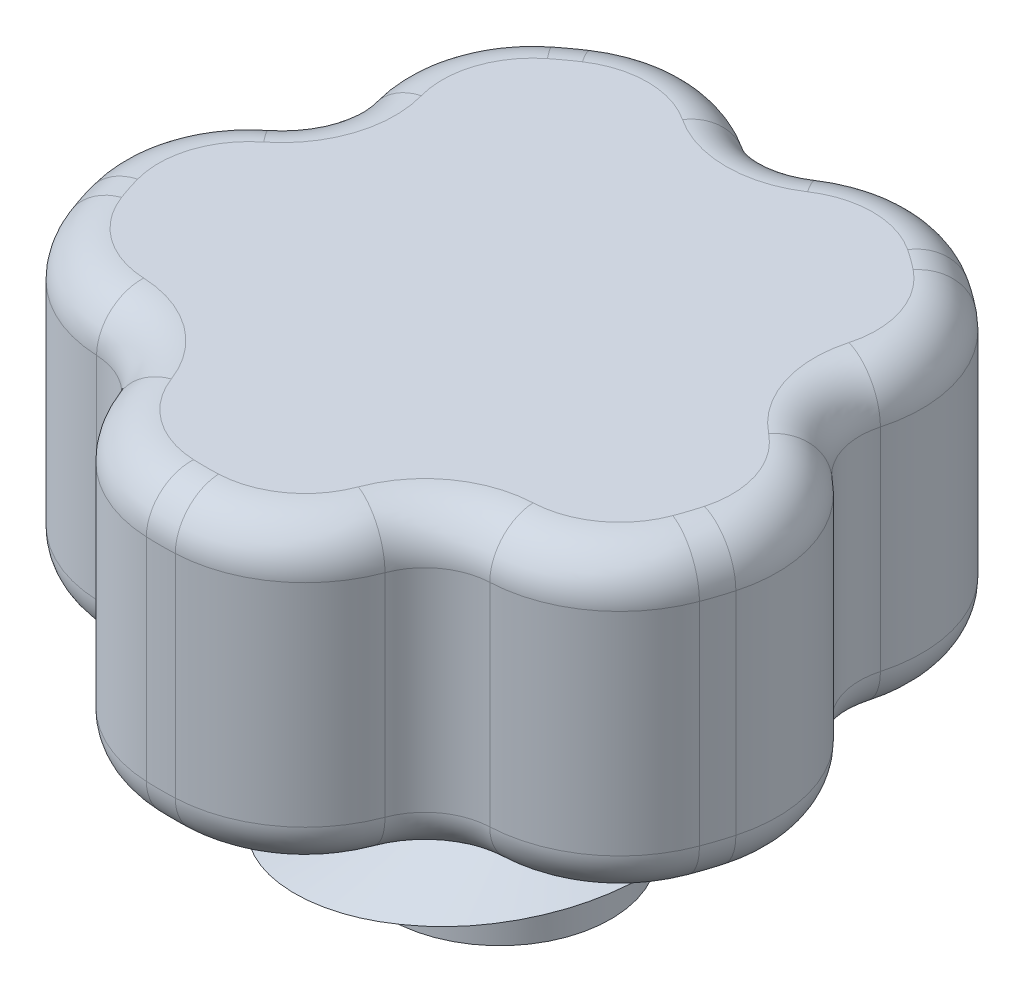
from build123d import *

# Parameters (mm, degrees)
SKETCH1_R           = 7.5
BOSS_EXTRUDE1_DEPTH = 6.68
SKETCH2_R           = 2.45
BOSS_EXTRUDE2_DEPTH = 4
SWEEP1_PITCH        = 4
SKETCH6_R           = 1.5
CUT_EXTRUDE1_DEPTH  = 17.75
FILLET2_R           = 3
FILLET3_R           = 1
FILLET4_R           = 1


with BuildPart() as part:
    # Sketch1 → Boss-Extrude1 (new body)
    with BuildSketch(Plane(origin=(0, 0, 0), x_dir=(1, 0, 0), z_dir=(0, 1, 0))):
        with Locations(Location((0, 0, 0), (0, 0, 270))):
            Circle(SKETCH1_R)
    extrude(amount=BOSS_EXTRUDE1_DEPTH)

    # Sketch2 → Boss-Extrude2 (add)
    with BuildSketch(Plane.XZ):
        with Locations(Location((0, 0, 0), (0, 0, 270))):
            Circle(SKETCH2_R)
    extrude(amount=BOSS_EXTRUDE2_DEPTH)

    # Sweep1: the profile of Sketch4 screwed along a right-hand helix of 1 turns, 12 arcs to a turn; built about Z, then put on its axis
    sweep1_z = Axis((0, 0, 0), (0, 0, 1))
    sweep1_corners = [(2.45, 0, 0), (2.45, 0, -0.75), (3.95, 0, 0), (2.45, 0, 0.75)]
    with BuildLine(mode=Mode.PRIVATE) as sweep1_profile:
        Line(sweep1_corners[0], sweep1_corners[1])
        Line(sweep1_corners[1], sweep1_corners[2])
        Line(sweep1_corners[2], sweep1_corners[3])
        Line(sweep1_corners[3], sweep1_corners[0])
    sweep1_cap = Face(sweep1_profile.wire())
    sweep1_turn_angles = [0, 15, 30, 45, 60, 75, 90, 105, 120, 135, 150, 165, 180, 195, 210, 225, 240, 255, 270, 285, 300, 315, 330, 345, 360]
    sweep1_turn_weights = [1, 0.9659258262890683, 1, 0.9659258262890683, 1, 0.9659258262890683, 1, 0.9659258262890683, 1, 0.9659258262890683, 1, 0.9659258262890683, 1, 0.9659258262890683, 1, 0.9659258262890683, 1, 0.9659258262890683, 1, 0.9659258262890683, 1, 0.9659258262890683, 1, 0.9659258262890683, 1]
    sweep1_turn_rails = [Edge.make_bspline([Vector(p[0], p[1], 0).rotate(sweep1_z, sweep1_turn_angles[k]) / sweep1_turn_weights[k] + Vector(0, 0, p[2] + SWEEP1_PITCH * sweep1_turn_angles[k] / 360) for k in range(25)], [0, 0, 0, 1, 1, 2, 2, 3, 3, 4, 4, 5, 5, 6, 6, 7, 7, 8, 8, 9, 9, 10, 10, 11, 11, 12, 12, 12], 2, sweep1_turn_weights) for p in sweep1_corners]
    sweep1_turn_sides = [Face.make_surface_from_curves(sweep1_turn_rails[p[0]], sweep1_turn_rails[p[1]]) for p in [(0, 1), (1, 2), (2, 3), (3, 0)]]
    sweep1 = Plane(origin=(0, -4, 0), x_dir=(-1, 0, 0), z_dir=(0, 1, 0)) * Solid(Shell([*sweep1_turn_sides, sweep1_cap, sweep1_cap.rotate(sweep1_z, 360).moved(Location((0, 0, SWEEP1_PITCH * 360 / 360)))]))
    add(sweep1)

    # Sketch6 → Cut-Extrude1 (cut)
    with BuildSketch(Plane(origin=(0, 6.68, 0), x_dir=(1, 0, 0), z_dir=(0, 1, 0))):
        with Locations((0, 7.5)):
            Circle(SKETCH6_R)
        with Locations((7.132923872, 2.317627458)):
            Circle(SKETCH6_R)
        with Locations((4.408389392, -6.067627458)):
            Circle(SKETCH6_R)
        with Locations((-4.408389392, -6.067627458)):
            Circle(SKETCH6_R)
        with Locations((-7.132923872, 2.317627458)):
            Circle(SKETCH6_R)
    extrude(amount=-CUT_EXTRUDE1_DEPTH, mode=Mode.SUBTRACT)

    # Fillet2
    fillet2_edges = [part.edges().sort_by_distance(p)[0] for p in [
        (1.492481156, 3.34, -7.35),
        (-1.492481156, 3.34, -7.35),
        (7.451467436, 3.34, -0.85184098),
        (6.529063354, 3.34, -3.690708837),
        (3.112778986, 3.34, 6.823533321),
        (5.527664223, 3.34, 5.069016496),
        (-5.527664223, 3.34, 5.069016496),
        (-3.112778986, 3.34, 6.823533321),
        (-6.529063354, 3.34, -3.690708837),
        (-7.451467436, 3.34, -0.85184098),
    ]]
    fillet(fillet2_edges, radius=FILLET2_R)

    # Fillet3
    fillet3_edges = [part.edges().sort_by_distance(p)[0] for p in [
        (-7.132923872, 6.68, 2.317627458),
        (0, 6.68, -6),
        (-4.408389392, 6.68, -6.067627458),
        (-5.706339098, 6.68, -1.854101966),
        (-3.526711514, 6.68, 4.854101966),
        (0, 6.68, 7.5),
        (3.526711514, 6.68, 4.854101966),
        (7.132923872, 6.68, 2.317627458),
        (5.706339098, 6.68, -1.854101966),
        (4.408389392, 6.68, -6.067627458),
        (-7.188301553, 6.68, 0.279858502),
        (-5.650961417, 6.68, -4.451587926),
        (-2.487468593, 6.68, -6.75),
        (2.487468593, 6.68, -6.75),
        (5.650961417, 6.68, -4.451587926),
        (7.188301553, 6.68, 0.279858502),
        (5.979954817, 6.68, 3.998767358),
        (1.955146088, 6.68, 6.922962066),
        (-1.955146088, 6.68, 6.922962066),
        (-5.979954817, 6.68, 3.998767358),
    ]]
    fillet(fillet3_edges, radius=FILLET3_R)

    # Fillet4
    fillet4_edges = [part.edges().sort_by_distance(p)[0] for p in [
        (-7.132923872, 0, 2.317627458),
        (-3.526711514, 0, 4.854101966),
        (-4.408389392, 0, -6.067627458),
        (0, 0, -6),
        (4.408389392, 0, -6.067627458),
        (5.706339098, 0, -1.854101966),
        (7.132923872, 0, 2.317627458),
        (3.526711514, 0, 4.854101966),
        (0, 0, 7.5),
        (-5.706339098, 0, -1.854101966),
        (-7.188301553, 0, 0.279858502),
        (-5.650961417, 0, -4.451587926),
        (-2.487468593, 0, -6.75),
        (2.487468593, 0, -6.75),
        (5.650961417, 0, -4.451587926),
        (7.188301553, 0, 0.279858502),
        (5.979954817, 0, 3.998767358),
        (1.955146088, 0, 6.922962066),
        (-1.955146088, 0, 6.922962066),
        (-5.979954817, 0, 3.998767358),
    ]]
    fillet(fillet4_edges, radius=FILLET4_R)


solid = part.part
